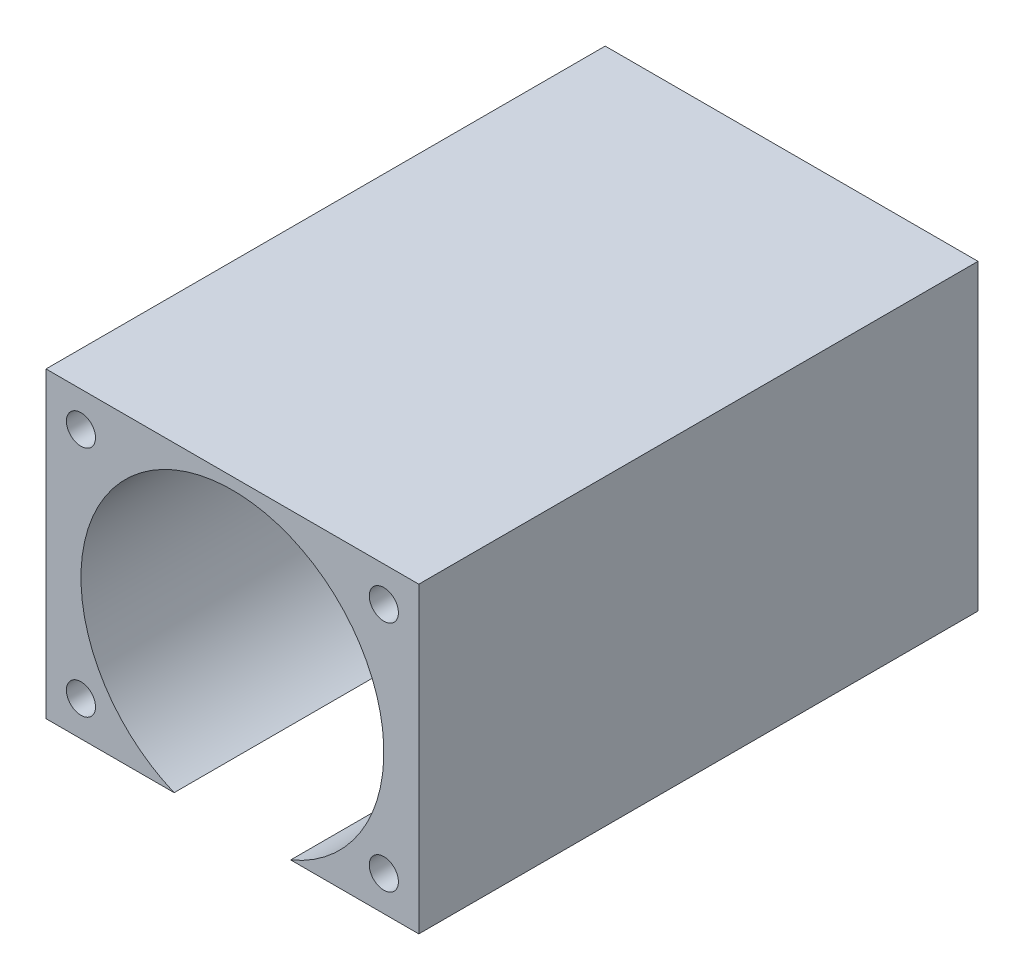
from build123d import *

# Parameters (mm, degrees)
BOSS_EXTRUDE1_DEPTH                   = 48
TAP_DRILL_FOR_M3_TAP1_D               = 2.5
TAP_DRILL_FOR_M3_TAP1_DEPTH           = 10
TAP_DRILL_FOR_M3_TAP1_TIP             = 0.751075774
TAP_DRILL_FOR_M3_TAP1_ON_FACE_2_D     = 2.5
TAP_DRILL_FOR_M3_TAP1_ON_FACE_2_DEPTH = 10
TAP_DRILL_FOR_M3_TAP1_ON_FACE_2_TIP   = 0.751075774


with BuildPart() as part:
    # Sketch1 → Boss-Extrude1 (new body)
    with BuildSketch(Plane.XY):
        with BuildLine():
            Line((-5, -12), (-16, -12))
            Line((-16, -12), (-16, 14))
            Line((-16, 14), (16, 14))
            Line((16, 14), (16, -12))
            Line((16, -12), (5, -12))
            ThreePointArc((5, -12), (0, 13), (-5, -12))
        make_face()
    extrude(amount=BOSS_EXTRUDE1_DEPTH)

    # Tap Drill for M3 Tap1
    with Locations(Plane(origin=(-13, 11, 48), x_dir=(1, 0, 0), z_dir=(0, 0, 1))):
        with Locations((0, 0), (26, 0), (26, -20), (0, -20)):
            Hole(TAP_DRILL_FOR_M3_TAP1_D / 2, depth=TAP_DRILL_FOR_M3_TAP1_DEPTH)
            with Locations((0, 0, -(TAP_DRILL_FOR_M3_TAP1_DEPTH + TAP_DRILL_FOR_M3_TAP1_TIP / 2))):  # 118° drill point
                Cone(0, TAP_DRILL_FOR_M3_TAP1_D / 2, TAP_DRILL_FOR_M3_TAP1_TIP, mode=Mode.SUBTRACT)

    # Tap Drill for M3 Tap1 on face 2
    with Locations(Plane(origin=(-13, -9, 0), x_dir=(-1, 0, 0), z_dir=(0, 0, -1))):
        with Locations((0, 0), (0, 20), (-26, 20), (-26, 0)):
            Hole(TAP_DRILL_FOR_M3_TAP1_ON_FACE_2_D / 2, depth=TAP_DRILL_FOR_M3_TAP1_ON_FACE_2_DEPTH)
            with Locations((0, 0, -(TAP_DRILL_FOR_M3_TAP1_ON_FACE_2_DEPTH + TAP_DRILL_FOR_M3_TAP1_ON_FACE_2_TIP / 2))):  # 118° drill point
                Cone(0, TAP_DRILL_FOR_M3_TAP1_ON_FACE_2_D / 2, TAP_DRILL_FOR_M3_TAP1_ON_FACE_2_TIP, mode=Mode.SUBTRACT)


solid = part.part
